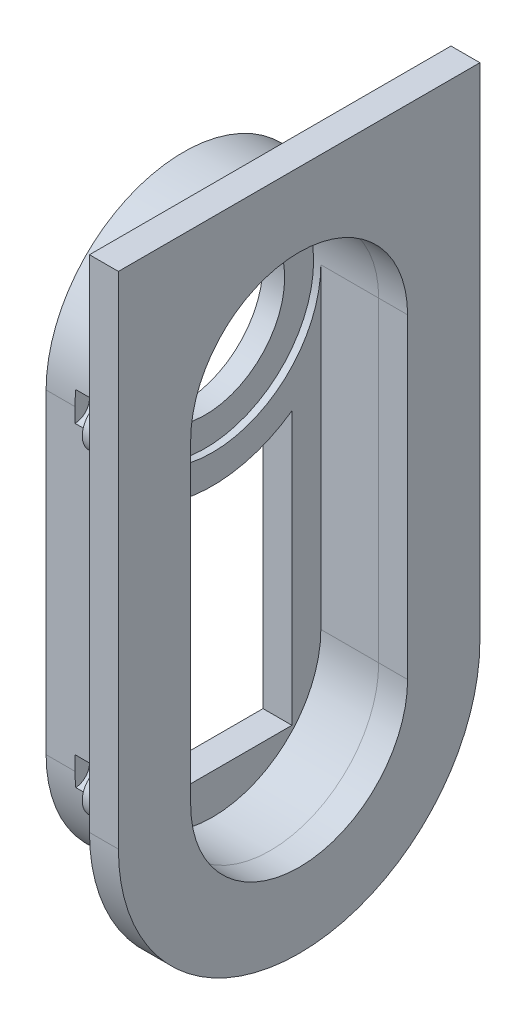
from build123d import *

# Parameters (mm, degrees)
SKETCH1_R           = 27.5
BOSS_EXTRUDE1_DEPTH = 10
BOSS_EXTRUDE2_DEPTH = 30
BOSS_EXTRUDE4_START = -10
BOSS_EXTRUDE4_DEPTH = 10
CUT_EXTRUDE1_START  = -2.5
SKETCH7_R           = 37.5
SKETCH7_R_2         = 27.25
CUT_EXTRUDE1_DEPTH  = 2.5
BOSS_EXTRUDE5_START = 10
BOSS_EXTRUDE5_DEPTH = 10
SKETCH9_R           = 5
CUT_EXTRUDE2_DEPTH  = 10


# Read off the part's stored shape, not the designer's step: Split1
with BuildPart() as part:
    # Sketch1 → Boss-Extrude1 (new body)
    with BuildSketch(Plane(origin=(0, 0, 0), x_dir=(0, 0, -1), z_dir=(1, 0, 0))):
        with BuildLine():
            Line((47.5, 0), (47.5, -109.208308594))
            ThreePointArc((47.5, -109.208308594), (0, -156.708308594), (-47.5, -109.208308594))
            Line((-47.5, -109.208308594), (-47.5, 0))
            ThreePointArc((-47.5, 0), (0, 47.5), (47.5, 0))
        make_face()
        Circle(SKETCH1_R, mode=Mode.SUBTRACT)
        with BuildLine():
            Line((27.5, -38.729833462), (27.5, -132.916779119))
            Line((27.5, -132.916779119), (-27.5, -132.916779119))
            Line((-27.5, -132.916779119), (-27.5, -38.729833462))
            ThreePointArc((-27.5, -38.729833462), (0, -47.5), (27.5, -38.729833462))
        make_face(mode=Mode.SUBTRACT)
    extrude(amount=BOSS_EXTRUDE1_DEPTH)

    # Sketch2 → Boss-Extrude2 (add)
    with BuildSketch(Plane(origin=(10, 0, 0), x_dir=(0, 0, -1), z_dir=(1, 0, 0))):
        with BuildLine():
            Line((-47.5, 0), (-47.5, -109.208308594))
            ThreePointArc((-47.5, -109.208308594), (0, -156.708308594), (47.5, -109.208308594))
            Line((47.5, -109.208308594), (47.5, 0))
            ThreePointArc((47.5, 0), (0, 47.5), (-47.5, 0))
        make_face()
        with BuildLine():
            Line((37.5, -109.208308594), (37.5, 0))
            ThreePointArc((37.5, 0), (0, 37.5), (-37.5, 0))
            Line((-37.5, 0), (-37.5, -109.208308594))
            ThreePointArc((-37.5, -109.208308594), (0, -146.708308594), (37.5, -109.208308594))
        make_face(mode=Mode.SUBTRACT)
    extrude(amount=BOSS_EXTRUDE2_DEPTH)

    # Sketch4 → Boss-Extrude4 (add)
    with BuildSketch(Plane(origin=(40, 0, 0), x_dir=(0, 0, -1), z_dir=(1, 0, 0)).offset(BOSS_EXTRUDE4_START)):
        with BuildLine():
            Line((62.5, -110), (62.5, 63))
            Line((62.5, 63), (-62.5, 63))
            Line((-62.5, 63), (-62.5, -110))
            ThreePointArc((-62.5, -110), (0, -172.5), (62.5, -110))
        make_face()
        with BuildLine():
            Line((-47.5, -109.208308594), (-47.5, 0))
            ThreePointArc((-47.5, 0), (0, 47.5), (47.5, 0))
            Line((47.5, 0), (47.5, -109.208308594))
            ThreePointArc((47.5, -109.208308594), (0, -156.708308594), (-47.5, -109.208308594))
        make_face(mode=Mode.SUBTRACT)
    extrude(amount=BOSS_EXTRUDE4_DEPTH)

    # Sketch7 → Cut-Extrude1 (cut)
    with BuildSketch(Plane(origin=(10, 0, 0), x_dir=(0, 0, -1), z_dir=(1, 0, 0)).offset(CUT_EXTRUDE1_START)):
        Circle(SKETCH7_R)
        Circle(SKETCH7_R_2, mode=Mode.SUBTRACT)
    extrude(amount=CUT_EXTRUDE1_DEPTH, mode=Mode.SUBTRACT)

    # Sketch8 → Boss-Extrude5 (add)
    with BuildSketch(Plane.ZY.offset(-30).offset(BOSS_EXTRUDE5_START)):
        with BuildLine():
            ThreePointArc((-47.5, -101.708308594), (-54.994145438, -109.504592507), (-46.907894737, -116.684899485))
            ThreePointArc((-46.907894737, -116.684899485), (-47.351742312, -112.958308594), (-47.5, -109.208308594))
            Line((-47.5, -109.208308594), (-47.5, -101.708308594))
        make_face()
        with BuildLine():
            ThreePointArc((7.5, -156.708308594), (7.494145438, -156.41202468), (7.476590891, -156.11620333))
            ThreePointArc((7.476590891, -156.11620333), (0, -156.708308594), (-7.476590891, -156.11620333))
            ThreePointArc((-7.476590891, -156.11620333), (-0.296283913, -164.202454031), (7.5, -156.708308594))
        make_face()
        with BuildLine():
            Line((47.5, -101.708308594), (47.5, -109.208308594))
            ThreePointArc((47.5, -109.208308594), (47.351742312, -112.958308594), (46.907894737, -116.684899485))
            ThreePointArc((46.907894737, -116.684899485), (52.589656694, -114.716974016), (55, -109.208308594))
            ThreePointArc((55, -109.208308594), (52.803300859, -103.905007735), (47.5, -101.708308594))
        make_face()
        with BuildLine():
            Line((47.5, 0), (47.5, -7.5))
            ThreePointArc((47.5, -7.5), (52.803300859, -5.303300859), (55, 0))
            ThreePointArc((55, 0), (52.589656694, 5.508665422), (46.907894737, 7.476590891))
            ThreePointArc((46.907894737, 7.476590891), (47.351742312, 3.75), (47.5, 0))
        make_face()
        with BuildLine():
            ThreePointArc((-47.5, 0), (-47.351742312, 3.75), (-46.907894737, 7.476590891))
            ThreePointArc((-46.907894737, 7.476590891), (-54.994145438, 0.296283913), (-47.5, -7.5))
            Line((-47.5, -7.5), (-47.5, 0))
        make_face()
        with BuildLine():
            ThreePointArc((-40, 0), (-41.991334578, 5.089656694), (-46.907894737, 7.476590891))
            ThreePointArc((-46.907894737, 7.476590891), (-47.351742312, 3.75), (-47.5, 0))
            Line((-47.5, 0), (-47.5, -7.5))
            ThreePointArc((-47.5, -7.5), (-42.196699141, -5.303300859), (-40, 0))
        make_face()
    extrude(amount=-BOSS_EXTRUDE5_DEPTH)

    # Sketch9 → Cut-Extrude2 (cut)
    with BuildSketch(Plane.ZY.offset(-20)):
        with Locations((0, -156.708308594)):
            Circle(SKETCH9_R)
        with Locations((47.5, -109.208308594)):
            Circle(SKETCH9_R)
        with Locations((47.5, 0)):
            Circle(SKETCH9_R)
        with Locations((-47.5, 0)):
            Circle(SKETCH9_R)
        with Locations((-47.5, -109.208308594)):
            Circle(SKETCH9_R)
    extrude(amount=CUT_EXTRUDE2_DEPTH, mode=Mode.SUBTRACT)


with BuildPart() as body_2:
    # Split1: the piece on the far side of the plane
    add(part.part)
    split(bisect_by=Plane.YZ.offset(30), keep=Keep.BOTTOM)


with BuildPart() as part_1:
    add(part.part)

    # Split1
    split(bisect_by=Plane.YZ.offset(30), keep=Keep.TOP)


solid = Compound([body_2.part, part_1.part])
